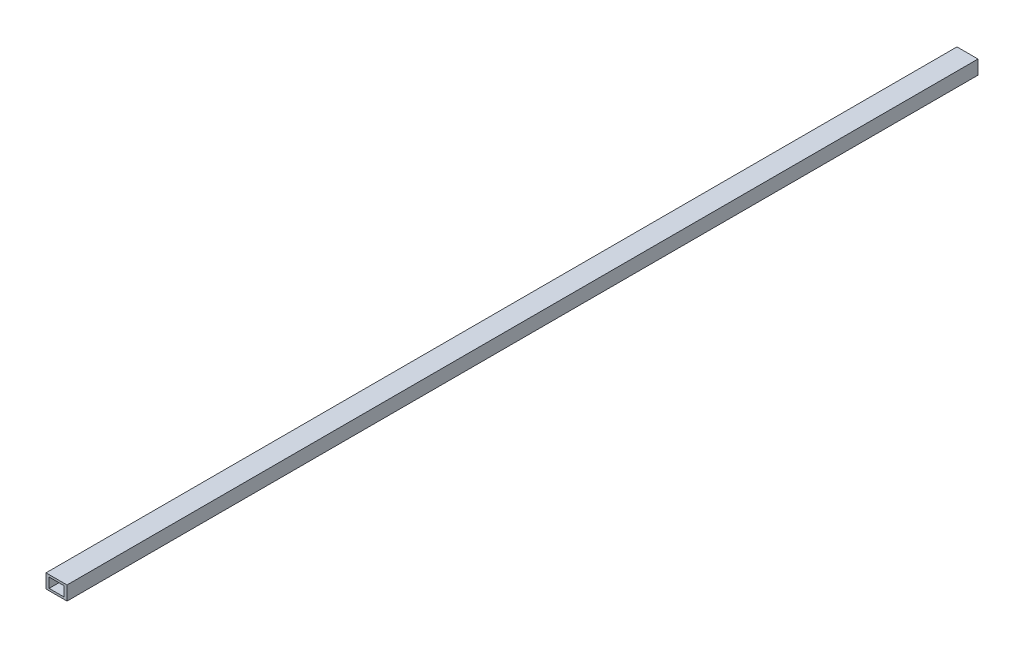
from build123d import *

# Parameters (mm, degrees)
SKETCH_1_W      = 15
SKETCH_1_H      = 10
SKETCH_1_W_2    = 10.5
SKETCH_1_H_2    = 7
EXTRUDE_1_DEPTH = 650


with BuildPart() as part:
    # 草图1 → 凸台-拉伸1 (new body)
    with BuildSketch(Plane.XY):
        Rectangle(SKETCH_1_W, SKETCH_1_H)
        Rectangle(SKETCH_1_W_2, SKETCH_1_H_2, mode=Mode.SUBTRACT)
    extrude(amount=EXTRUDE_1_DEPTH)


solid = part.part
